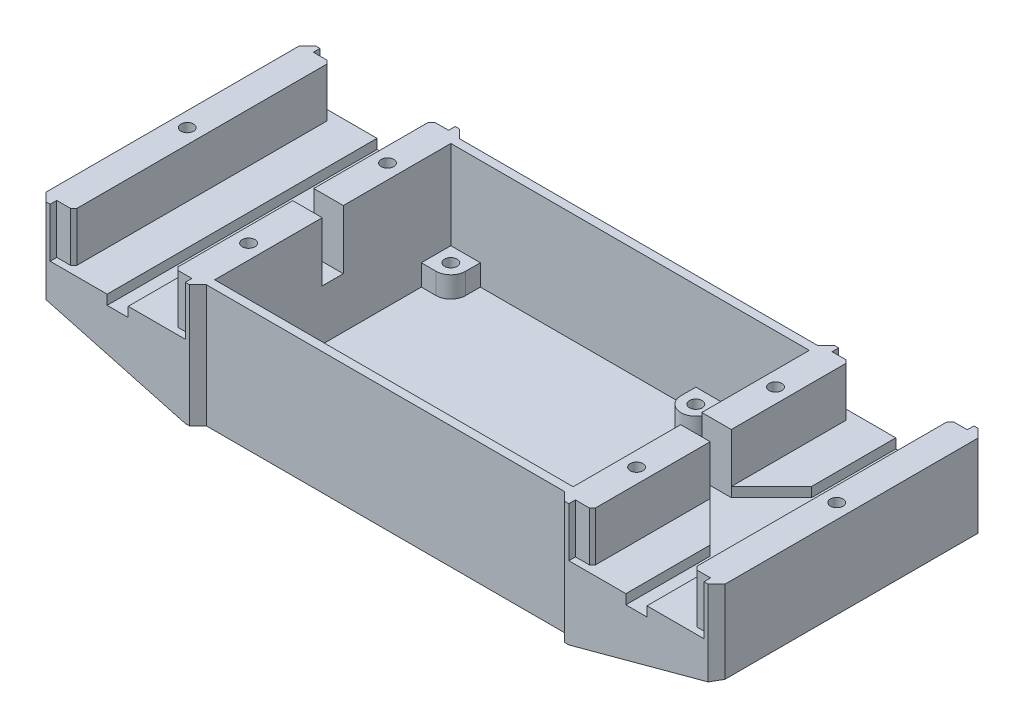
from build123d import *

# Parameters (mm, degrees)
SKETCH2_W            = 85
SKETCH2_H            = 56
BOSS_EXTRUDE4_DEPTH  = 3
SKETCH3_W            = 89
SKETCH3_H            = 60
SKETCH3_W_2          = 85
SKETCH3_H_2          = 56
BOSS_EXTRUDE5_DEPTH  = 29
SKETCH5_R            = 3.5
BOSS_EXTRUDE10_DEPTH = 8
CUT_EXTRUDE1_DEPTH   = 11.7
CHAMFER1_SIZE        = 2
CUT_EXTRUDE2_DEPTH   = 11.7
SKETCH8_W            = 64
SKETCH8_H            = 29
BOSS_EXTRUDE11_DEPTH = 2
SKETCH9_W            = 64
SKETCH9_H            = 29
BOSS_EXTRUDE12_DEPTH = 2
CHAMFER2_SIZE        = 2
CHAMFER3_SIZE        = 0.75
CUT_EXTRUDE4_DEPTH   = 107.851532511
SKETCH10_W           = 7.0025
SKETCH10_H           = 5
SKETCH10_W_2         = 85
SKETCH10_W_3         = 7
CUT_EXTRUDE5_DEPTH   = 14
CHAMFER4_SIZE        = 9.5
SKETCH14_R           = 1.5
CUT_EXTRUDE7_DEPTH   = 5
SKETCH15_R           = 1.5
CUT_EXTRUDE8_DEPTH   = 5


with BuildPart() as part:
    # Sketch2 → Boss-Extrude4 (new body)
    with BuildSketch(Plane(origin=(0, 0, 0), x_dir=(1, 0, 0), z_dir=(0, 1, 0))):
        Rectangle(SKETCH2_W, SKETCH2_H)
    extrude(amount=BOSS_EXTRUDE4_DEPTH)

    # Sketch3 → Boss-Extrude5 (add)
    # profile 1 of 3: a face of its own
    with BuildSketch(Plane(origin=(0, 0, 0), x_dir=(1, 0, 0), z_dir=(0, 1, 0))):
        Rectangle(SKETCH3_W, SKETCH3_H)
        Rectangle(SKETCH3_W_2, SKETCH3_H_2, mode=Mode.SUBTRACT)
    # profile 2 of 3: a face of its own
    with BuildSketch(Plane(origin=(0, 0, 0), x_dir=(1, 0, 0), z_dir=(0, 1, 0))):
        Polygon((-78.5, -32), (-44.5, -32), (-44.5, -30), (-44.5, 30), (-44.5, 32), (-78.5, 32), (-78.5, 0), align=None)
    # profile 3 of 3: a face of its own
    with BuildSketch(Plane(origin=(0, 0, 0), x_dir=(1, 0, 0), z_dir=(0, 1, 0))):
        Polygon((44.5, -32), (44.5, -30), (44.5, 30), (44.5, 32), (78.5, 32), (78.5, 0), (78.5, -32), align=None)
    extrude(amount=BOSS_EXTRUDE5_DEPTH)

    # Sketch5 → Boss-Extrude10 (add)
    with BuildSketch(Plane(origin=(0, 0, 0), x_dir=(1, 0, 0), z_dir=(0, 1, 0))):
        with Locations((-39, 24.5)):
            Circle(SKETCH5_R)
        with BuildLine():
            ThreePointArc((-42.5, 24.5), (-41.474873734, 26.974873734), (-39, 28))
            Line((-39, 28), (-42.5, 28))
            Line((-42.5, 28), (-42.5, 24.5))
        make_face()
        with BuildLine():
            ThreePointArc((-39, 21), (-41.474873734, 22.025126266), (-42.5, 24.5))
            Line((-42.5, 24.5), (-42.5, 21))
            Line((-42.5, 21), (-39, 21))
        make_face()
        with BuildLine():
            Line((-35.5, 24.5), (-35.5, 28))
            Line((-35.5, 28), (-39, 28))
            ThreePointArc((-39, 28), (-36.525126266, 26.974873734), (-35.5, 24.5))
        make_face()
        with BuildLine():
            ThreePointArc((-35.5, -24.5), (-36.525126266, -26.974873734), (-39, -28))
            Line((-39, -28), (-35.5, -28))
            Line((-35.5, -28), (-35.5, -24.5))
        make_face()
        with Locations((-39, -24.5)):
            Circle(SKETCH5_R)
        with BuildLine():
            ThreePointArc((-39, -28), (-41.474873734, -26.974873734), (-42.5, -24.5))
            Line((-42.5, -24.5), (-42.5, -28))
            Line((-42.5, -28), (-39, -28))
        make_face()
        with BuildLine():
            Line((-39, -21), (-42.5, -21))
            Line((-42.5, -21), (-42.5, -24.5))
            ThreePointArc((-42.5, -24.5), (-41.474873734, -22.025126266), (-39, -21))
        make_face()
        with BuildLine():
            Line((19.08999999, -28), (22.59, -28))
            Line((22.59, -28), (22.59, -24.5))
            ThreePointArc((22.59, -24.5), (21.564873731, -26.974873738), (19.08999999, -28))
        make_face()
        with Locations((19.09, -24.5)):
            Circle(SKETCH5_R)
        with BuildLine():
            Line((15.59, -28), (19.08999999, -28))
            ThreePointArc((19.08999999, -28), (16.615126262, -26.974873731), (15.59, -24.5))
            Line((15.59, -24.5), (15.59, -28))
        make_face()
        with BuildLine():
            ThreePointArc((19.09, 28), (21.564873734, 26.974873734), (22.59, 24.5))
            Line((22.59, 24.5), (22.59, 28))
            Line((22.59, 28), (19.09, 28))
        make_face()
        with BuildLine():
            Line((15.59, 28), (15.59, 24.5))
            ThreePointArc((15.59, 24.5), (16.615126266, 26.974873734), (19.09, 28))
            Line((19.09, 28), (15.59, 28))
        make_face()
        with Locations((19.09, 24.5)):
            Circle(SKETCH5_R)
    extrude(amount=BOSS_EXTRUDE10_DEPTH)

    # Sketch6 → Cut-Extrude1 (cut)
    with BuildSketch(Plane(origin=(0, 29, 0), x_dir=(1, 0, 0), z_dir=(0, 1, 0))):
        Polygon((-73.5025, 30.43), (-49.5025, 30.43), (-45.48, 30.43), (-45.48, 32), (-77.53, 32), (-77.53, 30.43), align=None)
        Polygon((-73.5025, -30.43), (-49.5025, -30.43), (-49.5025, 0), (-49.5025, 30.43), (-73.5025, 30.43), (-73.5025, 0), align=None)
        Polygon((-77.525, -32), (-45.475, -32), (-45.475, -30.43), (-49.5025, -30.43), (-73.5025, -30.43), (-77.525, -30.43), align=None)
    extrude(amount=-CUT_EXTRUDE1_DEPTH, mode=Mode.SUBTRACT)

    # Chamfer1
    chamfer1_edges = [part.edges().sort_by_distance(p)[0] for p in [
        (-44.5, 14.5, 30),
        (44.5, 14.5, 30),
        (44.5, 14.5, -30),
        (-44.5, 14.5, -30),
    ]]
    chamfer(chamfer1_edges, length=CHAMFER1_SIZE - 0.0001)  # a hair under: the kernel refuses the full size

    # Sketch7 → Cut-Extrude2 (cut)
    with BuildSketch(Plane(origin=(0, 29, 0), x_dir=(1, 0, 0), z_dir=(0, 1, 0))):
        Polygon((61.5, 32), (45.475, 32), (45.475, 30.43), (49.5, 30.43), (49.5, -30.43), (45.47, -30.43), (45.47, -32), (61.5, -32), (77.53, -32), (77.53, -30.43), (73.5, -30.43), (73.5, 30.43), (77.53, 30.43), (77.53, 32), align=None)
    extrude(amount=-CUT_EXTRUDE2_DEPTH, mode=Mode.SUBTRACT)

    # Sketch8 → Boss-Extrude11 (add)
    with BuildSketch(Plane.ZY.offset(78.5)):
        with Locations((0, 14.5)):
            Rectangle(SKETCH8_W, SKETCH8_H)
    extrude(amount=BOSS_EXTRUDE11_DEPTH)

    # Sketch9 → Boss-Extrude12 (add)
    with BuildSketch(Plane(origin=(78.5, 0, 0), x_dir=(0, 0, -1), z_dir=(1, 0, 0))):
        with Locations((0, 14.5)):
            Rectangle(SKETCH9_W, SKETCH9_H)
    extrude(amount=BOSS_EXTRUDE12_DEPTH)

    # Chamfer2
    chamfer2_edges = [part.edges().sort_by_distance(p)[0] for p in [
        (-80.5, 14.5, -32),
        (-80.5, 14.5, 32),
        (80.5, 14.5, 32),
        (80.5, 14.5, -32),
    ]]
    chamfer(chamfer2_edges, length=CHAMFER2_SIZE)

    # Chamfer3
    chamfer3_edges = [part.edges().sort_by_distance(p)[0] for p in [
        (-73.5025, 23.15, -30.43),
        (-49.5025, 23.15, -30.43),
        (-49.5025, 23.15, 30.43),
        (-73.5025, 23.15, 30.43),
        (73.5, 23.15, -30.43),
        (73.5, 23.15, 30.43),
        (49.5, 23.15, 30.43),
        (49.5, 23.15, -30.43),
    ]]
    chamfer(chamfer3_edges, length=CHAMFER3_SIZE)

    # Sketch11 → Cut-Extrude4 (cut, through all)
    with BuildSketch(Plane.XY.offset(32)):
        Polygon((104.627072185, -13.366120131), (45.47, 0), (77.53, 8.65), (97.251349741, 13.97095057), align=None)
        Polygon((-80.747190975, -16.87538219), (-45.475, 0), (-78.5, 0), (-78.5, 8.913143526), (-93.850671493, 13.056148468), align=None)
        Polygon((-45.475, 0), (-77.525, 8.65), (-78.5, 8.913143526), (-78.5, 0), align=None)
    extrude(amount=-CUT_EXTRUDE4_DEPTH, mode=Mode.SUBTRACT)

    # Sketch10 → Cut-Extrude5 (cut)
    with BuildSketch(Plane(origin=(0, 29, 0), x_dir=(1, 0, 0), z_dir=(0, 1, 0))):
        Polygon((-59.005, -32), (-59.005, 32), (-61.505, 32), (-64.005, 32), (-64.005, -32), (-61.5, -32), align=None)
        Polygon((-49.5025, 2.5), (-59.005, 2.5), (-59.005, 0), (-59.005, -2.5), (-49.5025, -2.5), align=None)
        with Locations((-46.00125, 0)):
            Rectangle(SKETCH10_W, SKETCH10_H)
        Rectangle(SKETCH10_W_2, SKETCH10_H)
        with Locations((46, 0)):
            Rectangle(SKETCH10_W_3, SKETCH10_H)
        Polygon((59.0025, 2.5), (49.5, 2.5), (49.5, -2.5), (59.0025, -2.5), (59.0025, 0), align=None)
        Polygon((64.0025, -32), (64.0025, 32), (61.5025, 32), (59.0025, 32), (59.0025, -32), (61.5, -32), align=None)
    extrude(amount=-CUT_EXTRUDE5_DEPTH, mode=Mode.SUBTRACT)

    # Chamfer4
    chamfer4_edges = [part.edges().sort_by_distance(p)[0] for p in [
        (-59.005, 16.15, -2.5),
        (59.0025, 16.15, -2.5),
        (59.0025, 16.15, 2.5),
        (-59.005, 16.15, 2.5),
    ]]
    chamfer(chamfer4_edges, length=CHAMFER4_SIZE)

    # Sketch14 → Cut-Extrude7 (cut)
    with BuildSketch(Plane(origin=(0, 8, 0), x_dir=(1, 0, 0), z_dir=(0, 1, 0))):
        with Locations(Location((19.09, -24.5, 0), (0, 0, 270))):
            Circle(SKETCH14_R)
        with Locations(Location((-39, -24.5, 0), (0, 0, 270))):
            Circle(SKETCH14_R)
        with Locations(Location((-39, 24.5, 0), (0, 0, 270))):
            Circle(SKETCH14_R)
        with Locations(Location((19.09, 24.5, 0), (0, 0, 270))):
            Circle(SKETCH14_R)
    extrude(amount=-CUT_EXTRUDE7_DEPTH, mode=Mode.SUBTRACT)

    # Sketch15 → Cut-Extrude8 (cut)
    with BuildSketch(Plane(origin=(0, 29, 0), x_dir=(1, 0, 0), z_dir=(0, 1, 0))):
        with Locations(Location((46, 16.465, 0), (0, 0, 270))):
            Circle(SKETCH15_R)
        with Locations(Location((46, -16.465, 0), (0, 0, 270))):
            Circle(SKETCH15_R)
        with Locations(Location((77, 0, 0), (0, 0, 270))):
            Circle(SKETCH15_R)
        with Locations(Location((-46.0025, 16.465, 0), (0, 0, 270))):
            Circle(SKETCH15_R)
        with Locations(Location((-46.00125, -16.465, 0), (0, 0, 270))):
            Circle(SKETCH15_R)
        with Locations(Location((-77.00125, 0, 0), (0, 0, 270))):
            Circle(SKETCH15_R)
    extrude(amount=-CUT_EXTRUDE8_DEPTH, mode=Mode.SUBTRACT)


solid = part.part
